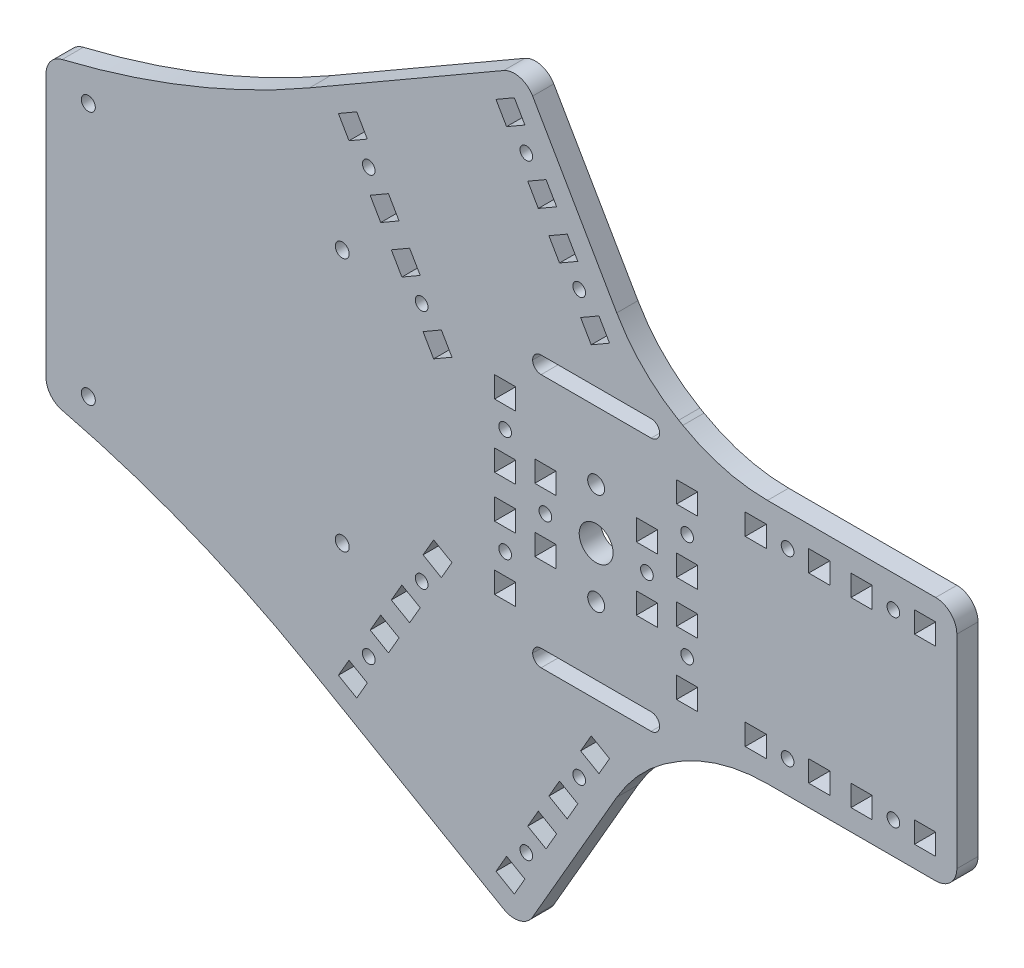
from build123d import *

# Parameters (mm, degrees)
ESQUISSE1_R        = 4
ESQUISSE1_R_2      = 2
ESQUISSE1_R_3      = 1.65
ESQUISSE1_R_4      = 1.5
ESQUISSE1_W        = 30
ESQUISSE1_H        = 4
ESQUISSE1_W_2      = 5
ESQUISSE1_H_2      = 5
BOSS_EXTRU_1_DEPTH = 5
CONG_1_R           = 2
CONG_2_R           = 5
CONG_3_R           = 40


with BuildPart() as part:
    # Esquisse1 → Boss.-Extru.1 (new body)
    with BuildSketch(Plane.XY):
        with BuildLine():
            Line((-130, 35), (-130, -35))
            ThreePointArc((-130, -35), (-97.944583636, -44.797961835), (-67.732250169, -59.315698604))
            Line((-67.732250169, -59.315698604), (-17.50277675, -88.315698604))
            Line((-17.50277675, -88.315698604), (10.229473419, -40.282032303))
            Line((10.229473419, -40.282032303), (20, -34.641016151))
            Line((20, -34.641016151), (29.770526581, -29))
            Line((29.770526581, -29), (85.235026919, -29))
            Line((85.235026919, -29), (85.235026919, 29))
            Line((85.235026919, 29), (29.770526581, 29))
            Line((29.770526581, 29), (20, 34.641016151))
            Line((20, 34.641016151), (10.229473419, 40.282032303))
            Line((10.229473419, 40.282032303), (-17.50277675, 88.315698604))
            Line((-17.50277675, 88.315698604), (-67.732250169, 59.315698604))
            ThreePointArc((-67.732250169, 59.315698604), (-97.944583636, 44.797961835), (-130, 35))
        make_face()
        Circle(ESQUISSE1_R, mode=Mode.SUBTRACT)
        with Locations((0, -12)):
            Circle(ESQUISSE1_R_2, mode=Mode.SUBTRACT)
        with Locations((0, 12)):
            Circle(ESQUISSE1_R_2, mode=Mode.SUBTRACT)
        with Locations((-60, 30)):
            Circle(ESQUISSE1_R_3, mode=Mode.SUBTRACT)
        with Locations(Location((-60, -30, 0), (0, 0, 180))):
            Circle(ESQUISSE1_R_3, mode=Mode.SUBTRACT)
        with Locations((-120, 30)):
            Circle(ESQUISSE1_R_3, mode=Mode.SUBTRACT)
        with Locations(Location((-120, -30, 0), (0, 0, 180))):
            Circle(ESQUISSE1_R_3, mode=Mode.SUBTRACT)
        with Locations(Location((45.235026919, 21.5, 0), (0, 0, 90))):
            Circle(ESQUISSE1_R_4, mode=Mode.SUBTRACT)
        with Locations((70.235026919, 21.5)):
            Circle(ESQUISSE1_R_4, mode=Mode.SUBTRACT)
        with Locations(Location((70.235026919, -21.5, 0), (0, 0, 180))):
            Circle(ESQUISSE1_R_4, mode=Mode.SUBTRACT)
        with Locations((45.235026919, -21.5)):
            Circle(ESQUISSE1_R_4, mode=Mode.SUBTRACT)
        with Locations(Location((-3.997967278, -49.924682453, 0), (0, 0, 180))):
            Circle(ESQUISSE1_R_4, mode=Mode.SUBTRACT)
        with Locations(Location((-16.497967278, -71.575317547, 0), (0, 0, 270))):
            Circle(ESQUISSE1_R_4, mode=Mode.SUBTRACT)
        with Locations(Location((-53.737059641, -50.075317547, 0), (0, 0, 90))):
            Circle(ESQUISSE1_R_4, mode=Mode.SUBTRACT)
        with Locations((-41.237059641, -28.424682453)):
            Circle(ESQUISSE1_R_4, mode=Mode.SUBTRACT)
        with Locations(Location((-41.237059641, 28.424682453, 0), (0, 0, 180))):
            Circle(ESQUISSE1_R_4, mode=Mode.SUBTRACT)
        with Locations((-53.737059641, 50.075317547)):
            Circle(ESQUISSE1_R_4, mode=Mode.SUBTRACT)
        with Locations(Location((-16.497967278, 71.575317547, 0), (0, 0, 90))):
            Circle(ESQUISSE1_R_4, mode=Mode.SUBTRACT)
        with Locations((-3.997967278, 49.924682453)):
            Circle(ESQUISSE1_R_4, mode=Mode.SUBTRACT)
        with Locations(Location((-21.5, -12.5, 0), (0, 0, 180))):
            Circle(ESQUISSE1_R_4, mode=Mode.SUBTRACT)
        with Locations(Location((-21.5, 12.5, 0), (0, 0, 270))):
            Circle(ESQUISSE1_R_4, mode=Mode.SUBTRACT)
        with Locations(Location((21.5, 12.5, 0), (0, 0, 90))):
            Circle(ESQUISSE1_R_4, mode=Mode.SUBTRACT)
        with Locations((21.5, -12.5)):
            Circle(ESQUISSE1_R_4, mode=Mode.SUBTRACT)
        with Locations(Location((12, 0, 0), (0, 0, 90))):
            Circle(ESQUISSE1_R_4, mode=Mode.SUBTRACT)
        with Locations(Location((-12, 0, 0), (0, 0, 90))):
            Circle(ESQUISSE1_R_4, mode=Mode.SUBTRACT)
        with Locations((0, -30)):
            Rectangle(ESQUISSE1_W, ESQUISSE1_H, mode=Mode.SUBTRACT)
        with Locations((0, 30)):
            Rectangle(ESQUISSE1_W, ESQUISSE1_H, mode=Mode.SUBTRACT)
        with Locations((52.735026919, 21.5)):
            Rectangle(ESQUISSE1_W_2, ESQUISSE1_H_2, mode=Mode.SUBTRACT)
        with Locations((37.735026919, 21.5)):
            Rectangle(ESQUISSE1_W_2, ESQUISSE1_H_2, mode=Mode.SUBTRACT)
        with Locations((62.735026919, 21.5)):
            Rectangle(ESQUISSE1_W_2, ESQUISSE1_H_2, mode=Mode.SUBTRACT)
        with Locations((77.735026919, 21.5)):
            Rectangle(ESQUISSE1_W_2, ESQUISSE1_H_2, mode=Mode.SUBTRACT)
        with Locations((62.735026919, -21.5)):
            Rectangle(ESQUISSE1_W_2, ESQUISSE1_H_2, mode=Mode.SUBTRACT)
        with Locations((77.735026919, -21.5)):
            Rectangle(ESQUISSE1_W_2, ESQUISSE1_H_2, mode=Mode.SUBTRACT)
        with Locations((52.735026919, -21.5)):
            Rectangle(ESQUISSE1_W_2, ESQUISSE1_H_2, mode=Mode.SUBTRACT)
        with Locations((37.735026919, -21.5)):
            Rectangle(ESQUISSE1_W_2, ESQUISSE1_H_2, mode=Mode.SUBTRACT)
        Polygon((-4.332903769, -55.504809472), (-6.832903769, -59.834936491), (-11.163030788, -57.334936491), (-8.663030788, -53.004809472), align=None, mode=Mode.SUBTRACT)
        Polygon((0.667096231, -46.844555434), (3.167096231, -42.514428415), (-1.163030788, -40.014428415), (-3.663030788, -44.344555434), align=None, mode=Mode.SUBTRACT)
        Polygon((-11.832903769, -68.495190528), (-9.332903769, -64.165063509), (-13.663030788, -61.665063509), (-16.163030788, -65.995190528), align=None, mode=Mode.SUBTRACT)
        Polygon((-16.832903769, -77.155444566), (-19.332903769, -81.485571585), (-23.663030788, -78.985571585), (-21.163030788, -74.655444566), align=None, mode=Mode.SUBTRACT)
        Polygon((-53.40212315, -44.495190528), (-50.90212315, -40.165063509), (-46.571996131, -42.665063509), (-49.071996131, -46.995190528), align=None, mode=Mode.SUBTRACT)
        Polygon((-58.40212315, -53.155444566), (-60.90212315, -57.485571585), (-56.571996131, -59.985571585), (-54.071996131, -55.655444566), align=None, mode=Mode.SUBTRACT)
        Polygon((-45.90212315, -31.504809472), (-48.40212315, -35.834936491), (-44.071996131, -38.334936491), (-41.571996131, -34.004809472), align=None, mode=Mode.SUBTRACT)
        Polygon((-40.90212315, -22.844555434), (-38.40212315, -18.514428415), (-34.071996131, -21.014428415), (-36.571996131, -25.344555434), align=None, mode=Mode.SUBTRACT)
        Polygon((-45.90212315, 31.504809472), (-48.40212315, 35.834936491), (-44.071996131, 38.334936491), (-41.571996131, 34.004809472), align=None, mode=Mode.SUBTRACT)
        Polygon((-40.90212315, 22.844555434), (-38.40212315, 18.514428415), (-34.071996131, 21.014428415), (-36.571996131, 25.344555434), align=None, mode=Mode.SUBTRACT)
        Polygon((-53.40212315, 44.495190528), (-50.90212315, 40.165063509), (-46.571996131, 42.665063509), (-49.071996131, 46.995190528), align=None, mode=Mode.SUBTRACT)
        Polygon((-58.40212315, 53.155444566), (-60.90212315, 57.485571585), (-56.571996131, 59.985571585), (-54.071996131, 55.655444566), align=None, mode=Mode.SUBTRACT)
        Polygon((-11.832903769, 68.495190528), (-9.332903769, 64.165063509), (-13.663030788, 61.665063509), (-16.163030788, 65.995190528), align=None, mode=Mode.SUBTRACT)
        Polygon((-16.832903769, 77.155444566), (-19.332903769, 81.485571585), (-23.663030788, 78.985571585), (-21.163030788, 74.655444566), align=None, mode=Mode.SUBTRACT)
        Polygon((-4.332903769, 55.504809472), (-6.832903769, 59.834936491), (-11.163030788, 57.334936491), (-8.663030788, 53.004809472), align=None, mode=Mode.SUBTRACT)
        Polygon((0.667096231, 46.844555434), (3.167096231, 42.514428415), (-1.163030788, 40.014428415), (-3.663030788, 44.344555434), align=None, mode=Mode.SUBTRACT)
        with Locations((-21.5, -5)):
            Rectangle(ESQUISSE1_W_2, ESQUISSE1_H_2, mode=Mode.SUBTRACT)
        with Locations((-21.5, -20)):
            Rectangle(ESQUISSE1_W_2, ESQUISSE1_H_2, mode=Mode.SUBTRACT)
        with Locations((-21.5, 5)):
            Rectangle(ESQUISSE1_W_2, ESQUISSE1_H_2, mode=Mode.SUBTRACT)
        with Locations((-21.5, 20)):
            Rectangle(ESQUISSE1_W_2, ESQUISSE1_H_2, mode=Mode.SUBTRACT)
        with Locations((21.5, 5)):
            Rectangle(ESQUISSE1_W_2, ESQUISSE1_H_2, mode=Mode.SUBTRACT)
        with Locations((21.5, 20)):
            Rectangle(ESQUISSE1_W_2, ESQUISSE1_H_2, mode=Mode.SUBTRACT)
        with Locations((21.5, -5)):
            Rectangle(ESQUISSE1_W_2, ESQUISSE1_H_2, mode=Mode.SUBTRACT)
        with Locations((21.5, -20)):
            Rectangle(ESQUISSE1_W_2, ESQUISSE1_H_2, mode=Mode.SUBTRACT)
        with Locations((12, -7.5)):
            Rectangle(ESQUISSE1_W_2, ESQUISSE1_H_2, mode=Mode.SUBTRACT)
        with Locations((12, 7.5)):
            Rectangle(ESQUISSE1_W_2, ESQUISSE1_H_2, mode=Mode.SUBTRACT)
        with Locations((-12, -7.5)):
            Rectangle(ESQUISSE1_W_2, ESQUISSE1_H_2, mode=Mode.SUBTRACT)
        with Locations((-12, 7.5)):
            Rectangle(ESQUISSE1_W_2, ESQUISSE1_H_2, mode=Mode.SUBTRACT)
    extrude(amount=BOSS_EXTRU_1_DEPTH)

    # Congé1
    cong_1_edges = [part.edges().sort_by_distance(p)[0] for p in [
        (-15, -32, 2.5),
        (-15, -28, 2.5),
        (15, -28, 2.5),
        (15, -32, 2.5),
        (15, 28, 2.5),
        (15, 32, 2.5),
        (-15, 28, 2.5),
        (-15, 32, 2.5),
    ]]
    fillet(cong_1_edges, radius=CONG_1_R - 0.0001)  # a hair under: the kernel refuses the full size

    # Congé2
    cong_2_edges = [part.edges().sort_by_distance(p)[0] for p in [
        (-17.50277675, -88.315698604, 2.5),
        (-130, -35, 2.5),
        (-130, 35, 2.5),
        (-17.50277675, 88.315698604, 2.5),
        (85.235026919, 29, 2.5),
        (85.235026919, -29, 2.5),
    ]]
    fillet(cong_2_edges, radius=CONG_2_R)

    # Congé3
    cong_3_edges = [part.edges().sort_by_distance(p)[0] for p in [
        (29.770526581, -29, 2.5),
        (10.229473419, -40.282032303, 2.5),
        (10.229473419, 40.282032303, 2.5),
        (29.770526581, 29, 2.5),
    ]]
    fillet(cong_3_edges, radius=CONG_3_R)


solid = part.part
